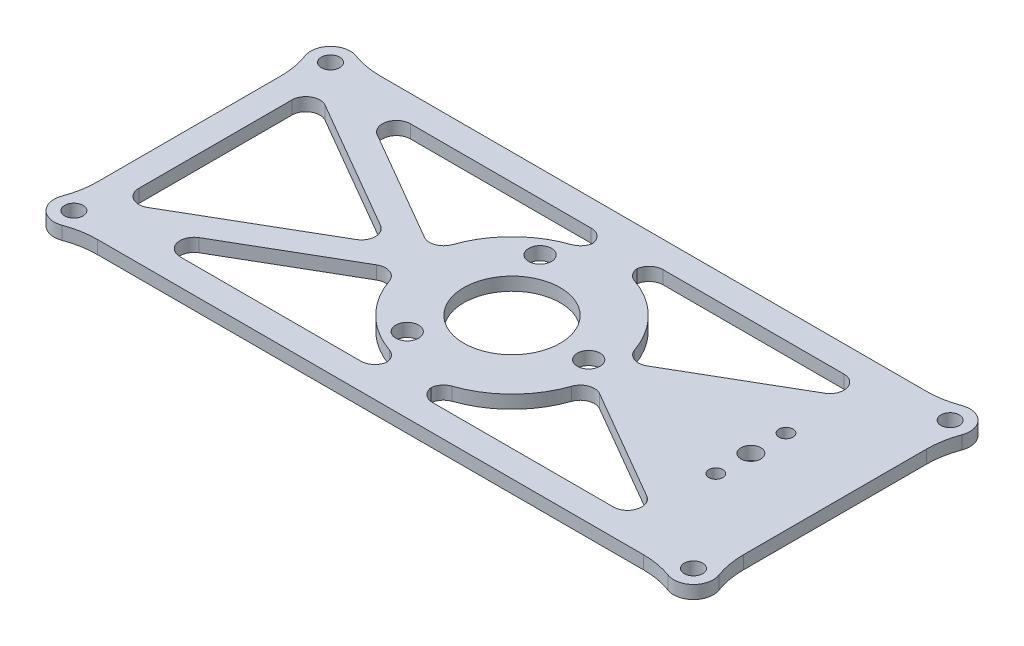
from build123d import *

# Parameters (mm, degrees)
SKETCH_1_R          = 2.1
EXTRUDE_1_DEPTH     = 3
SKETCH_1_R_2        = 22
SKETCH_1_R_3        = 2.6
SKETCH_1_R_4        = 11
EXTRUDE_1_2_DEPTH   = 3
EXTRUDE_START       = -3
EXTRUDE_2_DEPTH     = 3
FILLET_1_R          = 3.2
FILLET_2_R          = 20
EXTRUDE_4_DEPTH     = 3
SKETCH_4_R          = 2.25
SKETCH_4_R_2        = 1.6
CUT_EXTRUDE_1_DEPTH = 83.47010732


with BuildPart() as part:
    # 草图1 → 凸台-拉伸1 (new body)
    with BuildSketch(Plane(origin=(0, 0, 0), x_dir=(1, 0, 0), z_dir=(0, 1, 0))):
        with BuildLine():
            Line((-67.322682271, -32.275282576), (67.322682271, -32.275282576))
            ThreePointArc((67.322682271, -32.275282576), (73.858764752, -32.457263091), (73.676784237, -25.92118061))
            Line((73.676784237, -25.92118061), (73.676784237, 25.92118061))
            ThreePointArc((73.676784237, 25.92118061), (73.858764752, 32.457263091), (67.322682271, 32.275282576))
            Line((67.322682271, 32.275282576), (-67.322682271, 32.275282576))
            ThreePointArc((-67.322682271, 32.275282576), (-73.858764752, 32.457263091), (-73.676784237, 25.92118061))
            Line((-73.676784237, 25.92118061), (-73.676784237, -25.92118061))
            ThreePointArc((-73.676784237, -25.92118061), (-73.858764752, -32.457263091), (-67.322682271, -32.275282576))
        make_face()
        with Locations(Location((70.676784237, -29.275282576, 0), (0, 0, 270))):
            Circle(SKETCH_1_R, mode=Mode.SUBTRACT)
        with Locations(Location((-70.676784237, -29.275282576, 0), (0, 0, 270))):
            Circle(SKETCH_1_R, mode=Mode.SUBTRACT)
        with Locations(Location((70.676784237, 29.275282576, 0), (0, 0, 270))):
            Circle(SKETCH_1_R, mode=Mode.SUBTRACT)
        with Locations(Location((-70.676784237, 29.275282576, 0), (0, 0, 270))):
            Circle(SKETCH_1_R, mode=Mode.SUBTRACT)
        with BuildLine():
            Line((-67.322682271, 26.275282576), (67.322682271, 26.275282576))
            ThreePointArc((67.322682271, 26.275282576), (67.494803722, 26.093302061), (67.676784237, 25.92118061))
            Line((67.676784237, 25.92118061), (67.676784237, -25.92118061))
            ThreePointArc((67.676784237, -25.92118061), (67.494803722, -26.093302061), (67.322682271, -26.275282576))
            Line((67.322682271, -26.275282576), (-67.322682271, -26.275282576))
            ThreePointArc((-67.322682271, -26.275282576), (-67.494803722, -26.093302061), (-67.676784237, -25.92118061))
            Line((-67.676784237, -25.92118061), (-67.676784237, 25.92118061))
            ThreePointArc((-67.676784237, 25.92118061), (-67.494803722, 26.093302061), (-67.322682271, 26.275282576))
        make_face(mode=Mode.SUBTRACT)
    extrude(amount=EXTRUDE_1_DEPTH)



with BuildPart() as body_2:
    # 草图1 → Extrude 1 2 (new body)
    with BuildSketch(Plane(origin=(0, 0, 0), x_dir=(1, 0, 0), z_dir=(0, 1, 0))):
        with Locations(Location((0, 0, 0), (0, 0, 270))):
            Circle(SKETCH_1_R_2)
        with Locations(Location((-8.75, 15.155444566, 0), (0, 0, 270))):
            Circle(SKETCH_1_R_3, mode=Mode.SUBTRACT)
        with Locations(Location((0, 0, 0), (0, 0, 270))):
            Circle(SKETCH_1_R_4, mode=Mode.SUBTRACT)
        with Locations(Location((-8.75, -15.155444566, 0), (0, 0, 270))):
            Circle(SKETCH_1_R_3, mode=Mode.SUBTRACT)
        with Locations(Location((17.5, 0, 0), (0, 0, 270))):
            Circle(SKETCH_1_R_3, mode=Mode.SUBTRACT)
    extrude(amount=EXTRUDE_1_2_DEPTH)


with BuildPart() as part_1:
    add(part.part)

    add(body_2.part)  # 凸台-拉伸2 merges body 2
    # 草图2 → 凸台-拉伸2 (add)
    with BuildSketch(Plane(origin=(0, 3, 0), x_dir=(1, 0, 0), z_dir=(0, 1, 0)).offset(EXTRUDE_START)):
        with BuildLine():
            Line((-5, 26.275282576), (-5, 21.424285286))
            ThreePointArc((-5, 21.424285286), (0, 22), (5, 21.424285286))
            Line((5, 21.424285286), (5, 26.275282576))
            Line((5, 26.275282576), (-5, 26.275282576))
        make_face()
        with BuildLine():
            Line((5, -26.275282576), (5, -21.424285286))
            ThreePointArc((5, -21.424285286), (0, -22), (-5, -21.424285286))
            Line((-5, -21.424285286), (-5, -26.275282576))
            Line((-5, -26.275282576), (5, -26.275282576))
        make_face()
        with BuildLine():
            Line((-67.676784237, 23.012880146), (-27.981475463, 0))
            Line((-27.981475463, 0), (-67.676784237, -23.012880146))
            Line((-67.676784237, -23.012880146), (-67.676784237, -25.92118061))
            ThreePointArc((-67.676784237, -25.92118061), (-67.494803722, -26.093302061), (-67.322682271, -26.275282576))
            Line((-67.322682271, -26.275282576), (-61.341206808, -26.275282576))
            Line((-61.341206808, -26.275282576), (-21.747820556, -3.321490792))
            ThreePointArc((-21.747820556, -3.321490792), (-22, 0), (-21.747820556, 3.321490792))
            Line((-21.747820556, 3.321490792), (-61.341206808, 26.275282576))
            Line((-61.341206808, 26.275282576), (-67.322682271, 26.275282576))
            ThreePointArc((-67.322682271, 26.275282576), (-67.494803722, 26.093302061), (-67.676784237, 25.92118061))
            Line((-67.676784237, 25.92118061), (-67.676784237, 23.012880146))
        make_face()
        with BuildLine():
            Line((61.341206808, 26.275282576), (21.747820556, 3.321490792))
            ThreePointArc((21.747820556, 3.321490792), (22, 0), (21.747820556, -3.321490792))
            Line((21.747820556, -3.321490792), (61.341206808, -26.275282576))
            Line((61.341206808, -26.275282576), (67.322682271, -26.275282576))
            ThreePointArc((67.322682271, -26.275282576), (67.494803722, -26.093302061), (67.676784237, -25.92118061))
            Line((67.676784237, -25.92118061), (67.676784237, -23.012880146))
            Line((67.676784237, -23.012880146), (27.981475463, 0))
            Line((27.981475463, 0), (67.676784237, 23.012880146))
            Line((67.676784237, 23.012880146), (67.676784237, 25.92118061))
            ThreePointArc((67.676784237, 25.92118061), (67.494803722, 26.093302061), (67.322682271, 26.275282576))
            Line((67.322682271, 26.275282576), (61.341206808, 26.275282576))
        make_face()
    extrude(amount=EXTRUDE_2_DEPTH)

    # 圆角1
    # the kernel refuses this fillet: 3.2 mm, written as the material it adds along each edge
    with BuildSketch(Plane(origin=(-27.981475463, 0, 0), x_dir=(-0.8651295335829952, 0, -0.5015484922940843), z_dir=(0, 1, 0))) as fillet_1_piece_1:
        with BuildLine():
            CenterArc((FILLET_1_R * 1.72491702572, FILLET_1_R), FILLET_1_R, 150.205000829, 119.794999171)
            Line((FILLET_1_R * 0.857108199306, FILLET_1_R * 1.49689821976), (0, 0))
            Line((0, 0), (FILLET_1_R * 1.72491702572, 0))
        make_face()
    extrude(amount=3)
    with BuildSketch(Plane(origin=(-67.676784237, 0, 23.012880146), x_dir=(0, 0, -1), z_dir=(0, 1, 0))) as fillet_1_piece_2:
        with BuildLine():
            CenterArc((FILLET_1_R * 1.73563429984, -FILLET_1_R), FILLET_1_R, 90, 120.102500415)
            Line((FILLET_1_R * 0.87050476626, -FILLET_1_R * 1.50154849229), (0, 0))
            Line((0, 0), (FILLET_1_R * 1.73563429984, 0))
        make_face()
    extrude(amount=3)
    with BuildSketch(Plane(origin=(5, 0, 21.424285286), x_dir=(0, 0, 1), z_dir=(0, 1, 0)), Plane(origin=(-5, 0, -21.424285286), x_dir=(0, 0, -1), z_dir=(0, 1, 0))) as fillet_1_piece_3:
        with BuildLine():
            CenterArc((2.404269014, 3.2), FILLET_1_R, 198.989618262, 71.010381738)
            ThreePointArc((-0.621579151, 2.158730159), (-0.283217903, 1.087303995), (0, 0))
            Line((0, 0), (2.404269014, 0))
        make_face()
    extrude(amount=3)
    with BuildSketch(Plane(origin=(21.747820556, 0, 3.321490792), x_dir=(0.8651295335829955, 0, 0.5015484922940839), z_dir=(0, 1, 0)), Plane(origin=(-21.747820556, 0, -3.321490792), x_dir=(-0.8651295335829956, 0, -0.5015484922940837), z_dir=(0, 1, 0))) as fillet_1_piece_4:
        with BuildLine():
            CenterArc((4.251428919, -3.2), FILLET_1_R, 90, 101.059486295)
            ThreePointArc((1.110857558, -3.813849756), (0.641683834, -1.881801424), (0, 0))
            Line((0, 0), (4.251428919, 0))
        make_face()
    extrude(amount=3)
    with BuildSketch(Plane(origin=(61.341206808, 0, 26.275282576), x_dir=(-0.8651295335829955, 0, -0.5015484922940838), z_dir=(0, 1, 0)), Plane(origin=(61.341206808, 0, -26.275282576), x_dir=(-1, 0, 0), z_dir=(0, 1, 0)), Plane(origin=(-61.341206808, 0, 26.275282576), x_dir=(1, 0, 0), z_dir=(0, 1, 0))) as fillet_1_piece_5:
        with BuildLine():
            CenterArc((FILLET_1_R * 3.71874217995, FILLET_1_R), FILLET_1_R, 120.102500415, 149.897499585)
            Line((FILLET_1_R * 3.21719368765, FILLET_1_R * 1.86512953358), (0, 0))
            Line((0, 0), (FILLET_1_R * 3.71874217995, 0))
        make_face()
    extrude(amount=3)
    with BuildSketch(Plane(origin=(5, 0, 26.275282576), x_dir=(1, 0, 0), z_dir=(0, 1, 0)), Plane(origin=(-5, 0, -26.275282576), x_dir=(-1, 0, 0), z_dir=(0, 1, 0)), Plane(origin=(5, 0, -26.275282576), x_dir=(0, 0, 1), z_dir=(0, 1, 0)), Plane(origin=(-5, 0, 26.275282576), x_dir=(0, 0, -1), z_dir=(0, 1, 0))) as fillet_1_piece_6:
        with BuildLine():
            CenterArc((FILLET_1_R, FILLET_1_R), FILLET_1_R, 180, 90)
            Line((0, FILLET_1_R), (0, 0))
            Line((0, 0), (FILLET_1_R, 0))
        make_face()
    extrude(amount=3)
    with BuildSketch(Plane(origin=(-61.341206808, 0, -26.275282576), x_dir=(1, 0, 0), z_dir=(0, 1, 0))) as fillet_1_piece_7:
        with BuildLine():
            CenterArc((FILLET_1_R * 3.71874217995, -FILLET_1_R), FILLET_1_R, 90, 149.897499585)
            Line((FILLET_1_R * 3.21719368765, -FILLET_1_R * 1.86512953358), (0, 0))
            Line((0, 0), (FILLET_1_R * 3.71874217995, 0))
        make_face()
    extrude(amount=3)
    with BuildSketch(Plane(origin=(21.747820556, 0, -3.321490792), x_dir=(0.8651295335829948, 0, -0.5015484922940848), z_dir=(0, 1, 0)), Plane(origin=(-21.747820556, 0, 3.321490792), x_dir=(-0.8651295335829947, 0, 0.5015484922940853), z_dir=(0, 1, 0))) as fillet_1_piece_8:
        with BuildLine():
            CenterArc((4.251428919, 3.2), FILLET_1_R, 168.940513705, 101.059486295)
            ThreePointArc((1.110857558, 3.813849756), (0.641683834, 1.881801424), (0, 0))
            Line((0, 0), (4.251428919, 0))
        make_face()
    extrude(amount=3)
    with BuildSketch(Plane(origin=(5, 0, -21.424285286), x_dir=(0, 0, -1), z_dir=(0, 1, 0)), Plane(origin=(-5, 0, 21.424285286), x_dir=(0, 0, 1), z_dir=(0, 1, 0))) as fillet_1_piece_9:
        with BuildLine():
            CenterArc((2.404269014, -3.2), FILLET_1_R, 90, 71.010381738)
            ThreePointArc((-0.621579151, -2.158730159), (-0.283217903, -1.087303995), (0, 0))
            Line((0, 0), (2.404269014, 0))
        make_face()
    extrude(amount=3)
    with BuildSketch(Plane(origin=(-67.676784237, 0, -23.012880146), x_dir=(0, 0, 1), z_dir=(0, 1, 0))) as fillet_1_piece_10:
        with BuildLine():
            CenterArc((FILLET_1_R * 1.73563429984, FILLET_1_R), FILLET_1_R, 149.897499585, 120.102500415)
            Line((FILLET_1_R * 0.87050476626, FILLET_1_R * 1.50154849229), (0, 0))
            Line((0, 0), (FILLET_1_R * 1.73563429984, 0))
        make_face()
    extrude(amount=3)

    # 圆角2
    fillet_2_edges = [part_1.edges().sort_by_distance(p)[0] for p in [
        (-67.322682271, 1.5, 32.275282576),
        (-73.676784237, 1.5, 25.92118061),
        (-73.676784237, 1.5, -25.92118061),
        (-67.322682271, 1.5, -32.275282576),
        (67.322682271, 1.5, -32.275282576),
        (73.676784237, 1.5, -25.92118061),
        (73.676784237, 1.5, 25.92118061),
        (67.322682271, 1.5, 32.275282576),
    ]]
    fillet(fillet_2_edges, radius=FILLET_2_R)

    # 草图3 → 凸台-拉伸4 (add)
    with BuildSketch(Plane(origin=(0, 3, 0), x_dir=(1, 0, 0), z_dir=(0, 1, 0))):
        Polygon((67.676784237, 23.012880146), (27.981475463, 0), (67.676784237, -23.012880146), align=None)
    extrude(amount=-EXTRUDE_4_DEPTH)

    # 草图4 → 切除-拉伸1 (cut, through all)
    with BuildSketch(Plane(origin=(0, 3, 0), x_dir=(1, 0, 0), z_dir=(0, 1, 0))):
        with Locations(Location((54.5, 0, 0), (0, 0, 270))):
            Circle(SKETCH_4_R)
        with Locations(Location((54.5, 8, 0), (0, 0, 270))):
            Circle(SKETCH_4_R_2)
        with Locations(Location((54.5, -8, 0), (0, 0, 270))):
            Circle(SKETCH_4_R_2)
    extrude(amount=-CUT_EXTRUDE_1_DEPTH, mode=Mode.SUBTRACT)


solid = part_1.part
